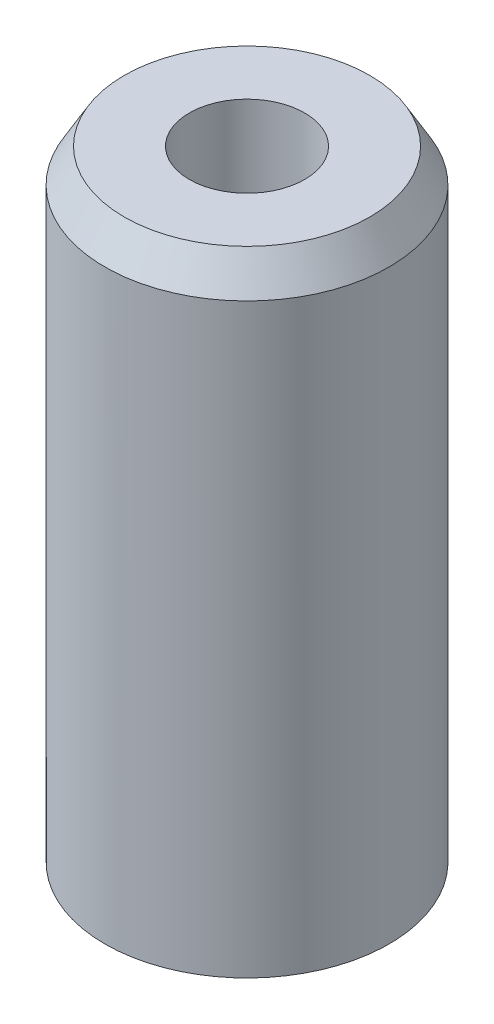
from build123d import *
from OCP.BRepFilletAPI import BRepFilletAPI_MakeChamfer

# Parameters (mm, degrees)
SKETCH1_R           = 15
BOSS_EXTRUDE1_DEPTH = 67.481559525
SKETCH2_R           = 6.087588224
CUT_EXTRUDE1_DEPTH  = 71.737266529
CHAMFER1_SIZE       = 3.544303814
CHAMFER1_SIZE2      = 2.046304761


with BuildPart() as part:
    # Sketch1 → Boss-Extrude1 (new body)
    with BuildSketch(Plane(origin=(0, 0, 0), x_dir=(1, 0, 0), z_dir=(0, 1, 0))):
        Circle(SKETCH1_R)
    extrude(amount=BOSS_EXTRUDE1_DEPTH)

    # Sketch2 → Cut-Extrude1 (cut, through all)
    with BuildSketch(Plane(origin=(0, 0, 0), x_dir=(1, 0, 0), z_dir=(0, 1, 0))):
        Circle(SKETCH2_R)
    extrude(amount=CUT_EXTRUDE1_DEPTH, mode=Mode.SUBTRACT)

    # Chamfer1: one chamfer whose edges measure the first distance from different faces: ONE call of the kernel's chamfer builder (chamfer() names one face for all edges)
    chamfer1_edges_1 = [part.edges().sort_by_distance(p)[0] for p in [
        (-15, 67.481559525, 0),
    ]]
    chamfer1_side_1 = [part.faces().sort_by_distance(p)[0] for p in [
        (-15, 33.740779763, 0),
    ]]
    chamfer1_edges_2 = [part.edges().sort_by_distance(p)[0] for p in [
        (-15, 0, 0),
    ]]
    chamfer1_side_2 = [part.faces().sort_by_distance(p)[0] for p in [
        (-14.575735931, 0, 0),
    ]]
    chamfer1 = BRepFilletAPI_MakeChamfer(part.part.solid().wrapped)
    for e in chamfer1_edges_1:
        chamfer1.Add(CHAMFER1_SIZE, CHAMFER1_SIZE2, e.wrapped, chamfer1_side_1[0].wrapped)  # the first distance lies on this face
    for e in chamfer1_edges_2:
        chamfer1.Add(CHAMFER1_SIZE, CHAMFER1_SIZE2, e.wrapped, chamfer1_side_2[0].wrapped)  # the first distance lies on this face
    add(Compound.cast(chamfer1.Shape()), mode=Mode.REPLACE)


solid = part.part
